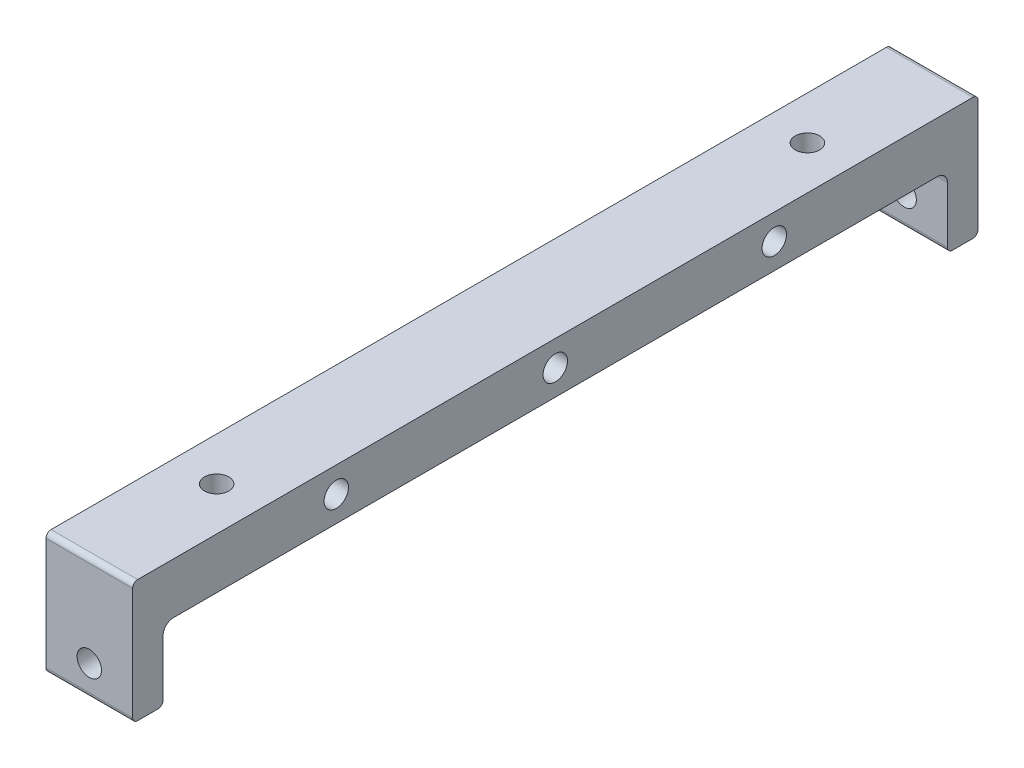
from build123d import *

# Parameters (mm, degrees)
SKETCH1_W              = 8.5
SKETCH1_H              = 12
BOSS_EXTRUDE1_DEPTH    = 41.5
CUT_EXTRUDE1_DEPTH     = 43.784342931
FILLET1_R              = 0.5
M2_HOLE1_R_D           = 2.4
M2_HOLE1_R_CSINK_D     = 4.4
M2_HOLE1_R_CSINK_ANGLE = 90
M2_HOLE2_T_D           = 2.4
M2_HOLE2_T_DEPTH       = 4
M2_HOLE2_T_TIP         = 0.721032743
M2_HOLE3_U_D           = 2.4
M2_HOLE3_U_DEPTH       = 10
M2_HOLE3_U_TIP         = 0.721032743
M2_HOLE4_V_D           = 2.4
M2_HOLE5_W_D           = 2.4
M2_HOLE5_W_DEPTH       = 5
M2_HOLE5_W_TIP         = 0.721032743
M2_HOLE6_Y_D           = 2.4
M2_HOLE6_Y_DEPTH       = 10
M2_HOLE6_Y_TIP         = 0.721032743


with BuildPart() as part:
    # Sketch1 → Boss-Extrude1 (new, symmetric)
    with BuildSketch(Plane.XY):
        Rectangle(SKETCH1_W, SKETCH1_H)
    extrude(amount=BOSS_EXTRUDE1_DEPTH, both=True)

    # Sketch2 → Cut-Extrude1 (cut, through all)
    with BuildSketch(Plane(origin=(4.25, 0, 0), x_dir=(0, 0, -1), z_dir=(1, 0, 0))):
        with BuildLine():
            Line((-37.5, 1), (37.5, 1))
            ThreePointArc((37.5, 1), (38.207106781, 0.707106781), (38.5, 0))
            Line((38.5, 0), (38.5, -6))
            Line((38.5, -6), (-38.5, -6))
            Line((-38.5, -6), (-38.5, 0))
            ThreePointArc((-38.5, 0), (-38.207106781, 0.707106781), (-37.5, 1))
        make_face()
    extrude(amount=-CUT_EXTRUDE1_DEPTH, mode=Mode.SUBTRACT)

    # Fillet1
    fillet1_edges = [part.edges().sort_by_distance(p)[0] for p in [
        (0, -6, 38.5),
        (0, -6, 41.5),
        (0, -6, -38.5),
        (0, -6, -41.5),
        (0, 6, 41.5),
        (0, 6, -41.5),
    ]]
    fillet(fillet1_edges, radius=FILLET1_R)

    # M2 Hole1 - R (through all)
    with Locations(Plane.ZY.offset(4.25)):
        with Locations((-21.5, 3.5), (21.5, 3.5)):
            CounterSinkHole(M2_HOLE1_R_D / 2, M2_HOLE1_R_CSINK_D / 2, counter_sink_angle=M2_HOLE1_R_CSINK_ANGLE)

    # M2 Hole2 - T
    with Locations(Plane(origin=(4.25, 0, 0), x_dir=(0, 0, -1), z_dir=(1, 0, 0))):
        with Locations((0, 3.5)):
            Hole(M2_HOLE2_T_D / 2, depth=M2_HOLE2_T_DEPTH)
            with Locations((0, 0, -(M2_HOLE2_T_DEPTH + M2_HOLE2_T_TIP / 2))):  # 118° drill point
                Cone(0, M2_HOLE2_T_D / 2, M2_HOLE2_T_TIP, mode=Mode.SUBTRACT)

    # M2 Hole3 - U
    with Locations(Plane.XY.offset(41.5)):
        with Locations((0, -3)):
            Hole(M2_HOLE3_U_D / 2, depth=M2_HOLE3_U_DEPTH)
            with Locations((0, 0, -(M2_HOLE3_U_DEPTH + M2_HOLE3_U_TIP / 2))):  # 118° drill point
                Cone(0, M2_HOLE3_U_D / 2, M2_HOLE3_U_TIP, mode=Mode.SUBTRACT)

    # M2 Hole4 - V (through all)
    with Locations(Plane(origin=(0, 6, 0), x_dir=(1, 0, 0), z_dir=(0, 1, 0))):
        with Locations((0, 29), (0, -29)):
            Hole(M2_HOLE4_V_D / 2)

    # M2 Hole5 - W
    with Locations(Plane.ZY.offset(4.25)):
        with Locations((-35.5, 3.5), (35.5, 3.5)):
            Hole(M2_HOLE5_W_D / 2, depth=M2_HOLE5_W_DEPTH)
            with Locations((0, 0, -(M2_HOLE5_W_DEPTH + M2_HOLE5_W_TIP / 2))):  # 118° drill point
                Cone(0, M2_HOLE5_W_D / 2, M2_HOLE5_W_TIP, mode=Mode.SUBTRACT)

    # M2 Hole6 - Y
    with Locations(Plane(origin=(0, 0, -41.5), x_dir=(-1, 0, 0), z_dir=(0, 0, -1))):
        with Locations((0, -3)):
            Hole(M2_HOLE6_Y_D / 2, depth=M2_HOLE6_Y_DEPTH)
            with Locations((0, 0, -(M2_HOLE6_Y_DEPTH + M2_HOLE6_Y_TIP / 2))):  # 118° drill point
                Cone(0, M2_HOLE6_Y_D / 2, M2_HOLE6_Y_TIP, mode=Mode.SUBTRACT)


solid = part.part
